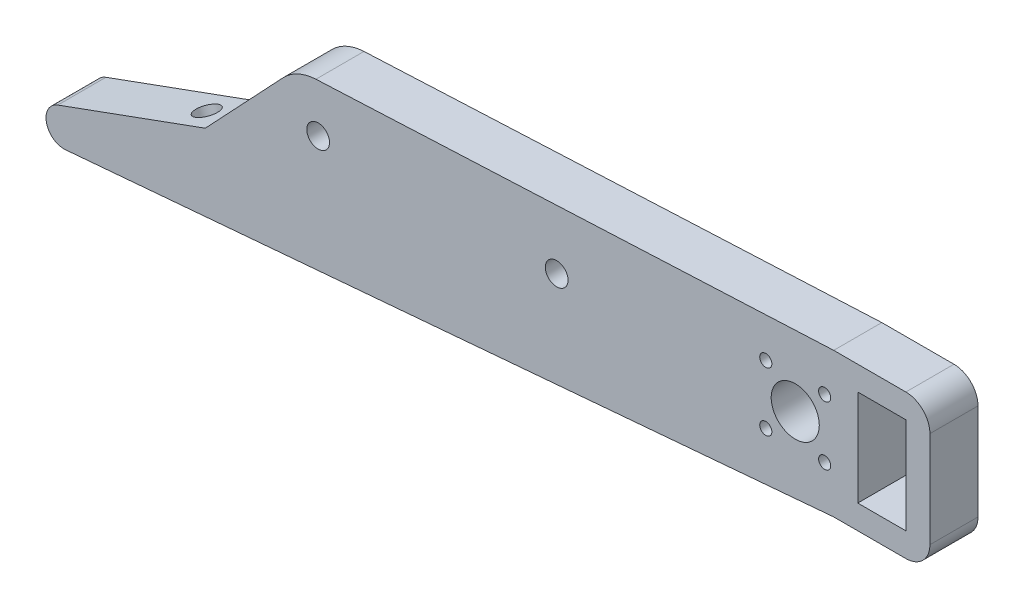
from build123d import *

# Parameters (mm, degrees)
SKETCH1_R           = 1.499997
SKETCH1_R_2         = 0.8
SKETCH1_R_3         = 3.175
SKETCH1_W           = 6.35
SKETCH1_H           = 12.7
BOSS_EXTRUDE1_DEPTH = 3.175
FILLET1_R           = 3.175
SKETCH2_R           = 1.5
CUT_EXTRUDE1_DEPTH  = 6


with BuildPart() as part:
    # Sketch1 → Boss-Extrude1 (new, symmetric)
    with BuildSketch(Plane.XY):
        with BuildLine():
            Line((49.276, 9.525), (36.576, 9.525))
            Line((36.576, 9.525), (-31.791214639, 6.343133951))
            ThreePointArc((-31.791214639, 6.343133951), (-34.148654973, 5.769395254), (-36.118832942, 4.353379789))
            Line((-36.118832942, 4.353379789), (-46.397973184, -6.561989517))
            Line((-46.397973184, -6.561989517), (-65.861496639, -13.646132709))
            ThreePointArc((-65.861496639, -13.646132709), (-67.372222956, -16.397560002), (-64.842812423, -18.25625))
            Line((-64.842812423, -18.25625), (36.576, -9.525))
            Line((36.576, -9.525), (49.276, -9.525))
            Line((49.276, -9.525), (49.276, 9.525))
        make_face()
        with Locations((-31.496, 0)):
            Circle(SKETCH1_R, mode=Mode.SUBTRACT)
        Circle(SKETCH1_R, mode=Mode.SUBTRACT)
        with Locations((27.606912703, -3.889087297)):
            Circle(SKETCH1_R_2, mode=Mode.SUBTRACT)
        with Locations((35.385087297, -3.889087297)):
            Circle(SKETCH1_R_2, mode=Mode.SUBTRACT)
        with Locations((31.496, 0)):
            Circle(SKETCH1_R_3, mode=Mode.SUBTRACT)
        with Locations((42.926, 0)):
            Rectangle(SKETCH1_W, SKETCH1_H, mode=Mode.SUBTRACT)
        with Locations((27.606912703, 3.889087297)):
            Circle(SKETCH1_R_2, mode=Mode.SUBTRACT)
        with Locations((35.385087297, 3.889087297)):
            Circle(SKETCH1_R_2, mode=Mode.SUBTRACT)
    extrude(amount=BOSS_EXTRUDE1_DEPTH, both=True)

    # Fillet1
    fillet1_edges = [part.edges().sort_by_distance(p)[0] for p in [
        (49.276, -9.525, 0),
        (49.276, 9.525, 0),
    ]]
    fillet(fillet1_edges, radius=FILLET1_R)

    # Sketch2 → Cut-Extrude1 (cut)
    with BuildSketch(Plane(origin=(-3.318549049, 9.117638577, 0), x_dir=(0.9396926207859105, 0.34202014332566305, 0), z_dir=(-0.34202014332566305, 0.9396926207859105, 0))):
        with Locations((-49.019165615, 0)):
            Circle(SKETCH2_R)
    extrude(amount=-CUT_EXTRUDE1_DEPTH, mode=Mode.SUBTRACT)


solid = part.part
